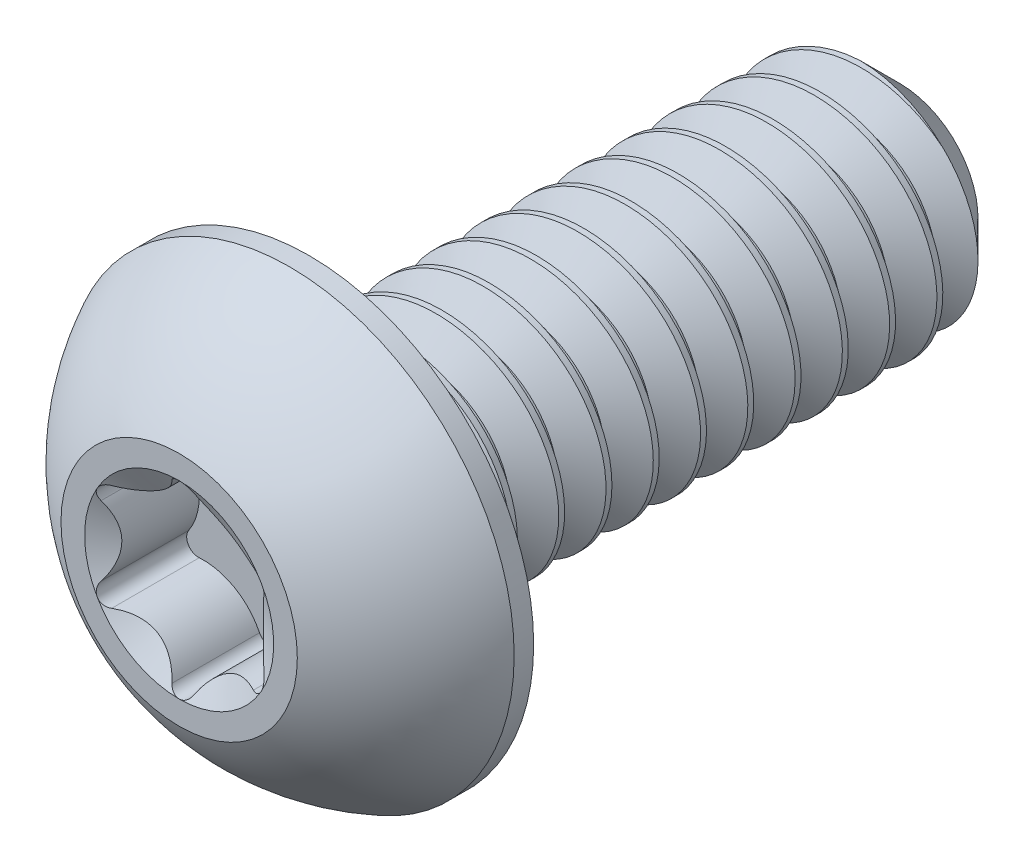
from build123d import *

# Parameters (mm, degrees)
SKETCH1_W          = 5
SKETCH1_H          = 1
CHAMFER1_SIZE      = 0.34
CUT_SWEEP1_PITCH   = 0.4
CUT_EXTRUDE2_DEPTH = 0.77
CIRPATTERN1_COUNT  = 6


with BuildPart() as part:
    # Sketch1 → Revolve1 (revolve)
    with BuildSketch(Plane(origin=(0, 0, 0), x_dir=(0, 0, -1), z_dir=(1, 0, 0))):
        with Locations((3.6, 0.5)):
            Rectangle(SKETCH1_W, SKETCH1_H)
    revolve(axis=Axis((0, 0, -6.1), (0, 0, 1)))

    # Chamfer1
    chamfer1_edges = [part.edges().sort_by_distance(p)[0] for p in [
        (0, -1, -6.1),
    ]]
    chamfer(chamfer1_edges, length=CHAMFER1_SIZE)

    # Cut-Sweep1: arcs per turn and ends read off the stored shape
    # Cut-Sweep1: the profile of Sketch2 profile screwed along a right-hand helix through 13 turns, 6 arcs to a turn; built about Z, then put on its axis
    cut_sweep1_z = Axis((0, 0, 0), (0, 0, 1))
    cut_sweep1_corners = [(1.0003, 0, 0.340173205), (1.0003, 0, -0.010173205), (0.740192379, 0, 0.14), (0.740192379, 0, 0.19)]
    with BuildLine(mode=Mode.PRIVATE) as cut_sweep1_profile:
        Line(cut_sweep1_corners[0], cut_sweep1_corners[1])
        Line(cut_sweep1_corners[1], cut_sweep1_corners[2])
        Line(cut_sweep1_corners[2], cut_sweep1_corners[3])
        Line(cut_sweep1_corners[3], cut_sweep1_corners[0])
    cut_sweep1_cap = Face(cut_sweep1_profile.wire())
    cut_sweep1_turn_angles = [0, 30, 60, 90, 120, 150, 180, 210, 240, 270, 300, 330, 360]
    cut_sweep1_turn_weights = [1, 0.8660254037844387, 1, 0.8660254037844387, 1, 0.8660254037844387, 1, 0.8660254037844387, 1, 0.8660254037844387, 1, 0.8660254037844387, 1]
    cut_sweep1_turn_rails = [Edge.make_bspline([Vector(p[0], p[1], 0).rotate(cut_sweep1_z, cut_sweep1_turn_angles[k]) / cut_sweep1_turn_weights[k] + Vector(0, 0, p[2] + CUT_SWEEP1_PITCH * cut_sweep1_turn_angles[k] / 360) for k in range(13)], [0, 0, 0, 1, 1, 2, 2, 3, 3, 4, 4, 5, 5, 6, 6, 6], 2, cut_sweep1_turn_weights) for p in cut_sweep1_corners]
    cut_sweep1_turn_sides = [Face.make_surface_from_curves(cut_sweep1_turn_rails[p[0]], cut_sweep1_turn_rails[p[1]]) for p in [(0, 1), (1, 2), (2, 3), (3, 0)]]
    cut_sweep1 = Plane(origin=(0, 0, -6.1), x_dir=(0, 1, 0), z_dir=(0, 0, 1)) * Solid(Shell([*[p.moved(Location((0, 0, CUT_SWEEP1_PITCH * i))) for i in range(13) for p in cut_sweep1_turn_sides], cut_sweep1_cap, cut_sweep1_cap.rotate(cut_sweep1_z, 4680).moved(Location((0, 0, CUT_SWEEP1_PITCH * 4680 / 360)))]))
    add(cut_sweep1, mode=Mode.SUBTRACT)

    # Sketch7 → Revolve2 (revolve)
    with BuildSketch(Plane(origin=(0, 0, 0), x_dir=(0, 0, -1), z_dir=(1, 0, 0)), mode=Mode.PRIVATE) as revolve2_sk:
        with BuildLine():
            Line((0.935, 1.9), (1.1, 1.9))
            Line((1.1, 1.9), (1.1, 0))
            Line((1.1, 0), (0, 0))
            Line((0, 0), (0, 1))
            ThreePointArc((0, 1), (0.396750073, 1.523501313), (0.935, 1.9))
        make_face()
    revolve(revolve2_sk.sketch.rotate(Axis((0, 0, 0), (0, 0, -1)), 180), axis=Axis((0, 0, 0), (0, 0, -1)))

    # Sketch5 → Cut-Extrude2 (cut)
    with BuildSketch(Plane.XY):
        with BuildLine():
            Line((0, 0), (-0.692820323, 0.4))
            ThreePointArc((-0.692820323, 0.4), (-0.706163843, 0.346715947), (-0.68935124, 0.294422772))
            ThreePointArc((-0.68935124, 0.294422772), (-0.6, 0), (-0.68935124, -0.294422772))
            ThreePointArc((-0.68935124, -0.294422772), (-0.706163843, -0.346715947), (-0.692820323, -0.4))
            Line((-0.692820323, -0.4), (0, 0))
        make_face()
    cut_extrude2 = extrude(amount=-CUT_EXTRUDE2_DEPTH, mode=Mode.SUBTRACT)

    # CirPattern1: Cut-Extrude2 ×6 about axis
    cirpattern1_axis = Axis((0, 0, 0), (0, 0, 1))
    for i in range(1, CIRPATTERN1_COUNT):
        add(cut_extrude2.rotate(cirpattern1_axis, i * 360 / CIRPATTERN1_COUNT), mode=Mode.SUBTRACT)

    # Cut-Extrude3 cone 1 section (through the dimple's axis) → Cut-Extrude3 (revolve, cut)
    with BuildSketch(Plane(origin=(0, 0, 0), x_dir=(0, -1, 0), z_dir=(1, 0, 0))):
        Polygon((0, 0), (0.8, 0), (0, 0.461880215), align=None)
    revolve(axis=Axis((0, 0, 0), (0, 0, -1)), mode=Mode.SUBTRACT)


solid = part.part
